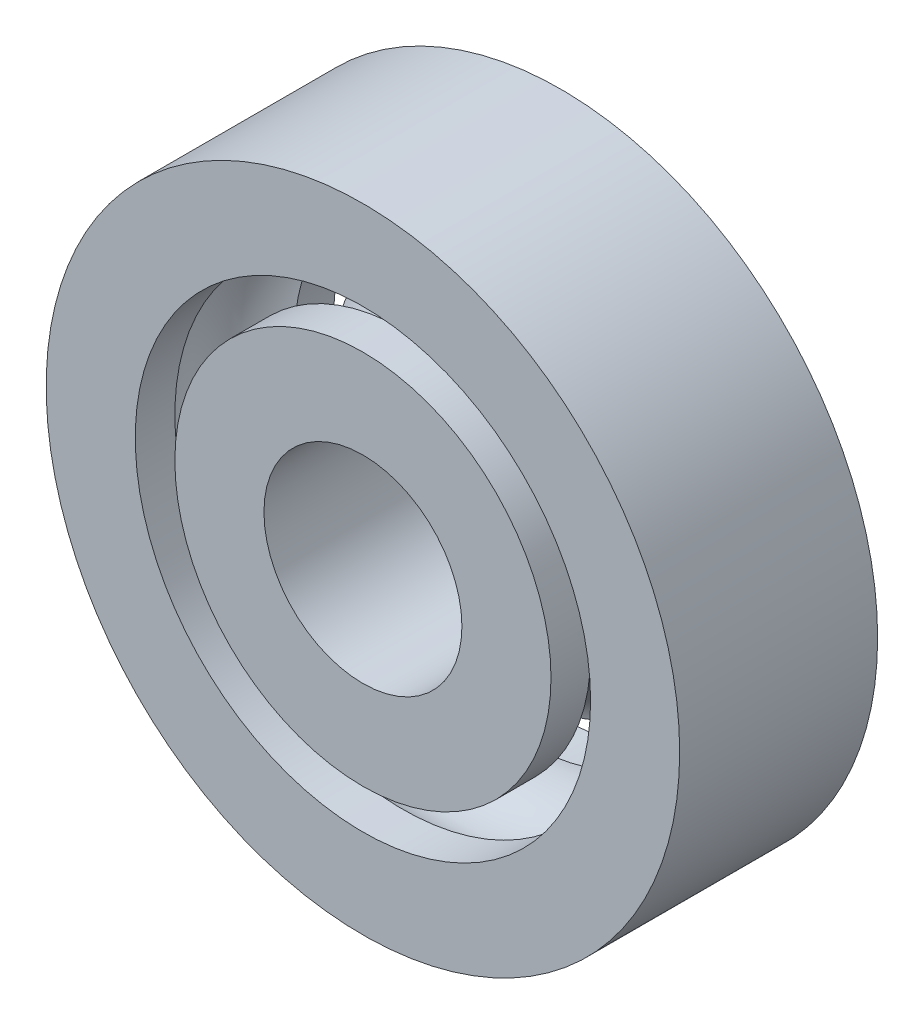
from build123d import *


with BuildPart() as part:
    # Sketch3 → Revolve1 (revolve)
    with BuildSketch(Plane(origin=(0, 0, 0), x_dir=(0, 0, -1), z_dir=(1, 0, 0))):
        with BuildLine():
            Line((-2.5, 4.75), (-2.5, 2.5))
            Line((-2.5, 2.5), (2.5, 2.5))
            Line((2.5, 2.5), (2.5, 4.75))
            Line((2.5, 4.75), (1.5, 4.75))
            ThreePointArc((1.5, 4.75), (0, 3.66886117), (-1.5, 4.75))
            Line((-1.5, 4.75), (-2.5, 4.75))
        make_face()
        with BuildLine():
            Line((2.5, 8), (-2.5, 8))
            Line((-2.5, 8), (-2.5, 5.75))
            Line((-2.5, 5.75), (-1.5, 5.75))
            ThreePointArc((-1.5, 5.75), (0, 6.83113883), (1.5, 5.75))
            Line((1.5, 5.75), (2.5, 5.75))
            Line((2.5, 5.75), (2.5, 8))
        make_face()
    revolve(axis=Axis((0, 0, 2.5), (0, 0, -1)))


solid = part.part
